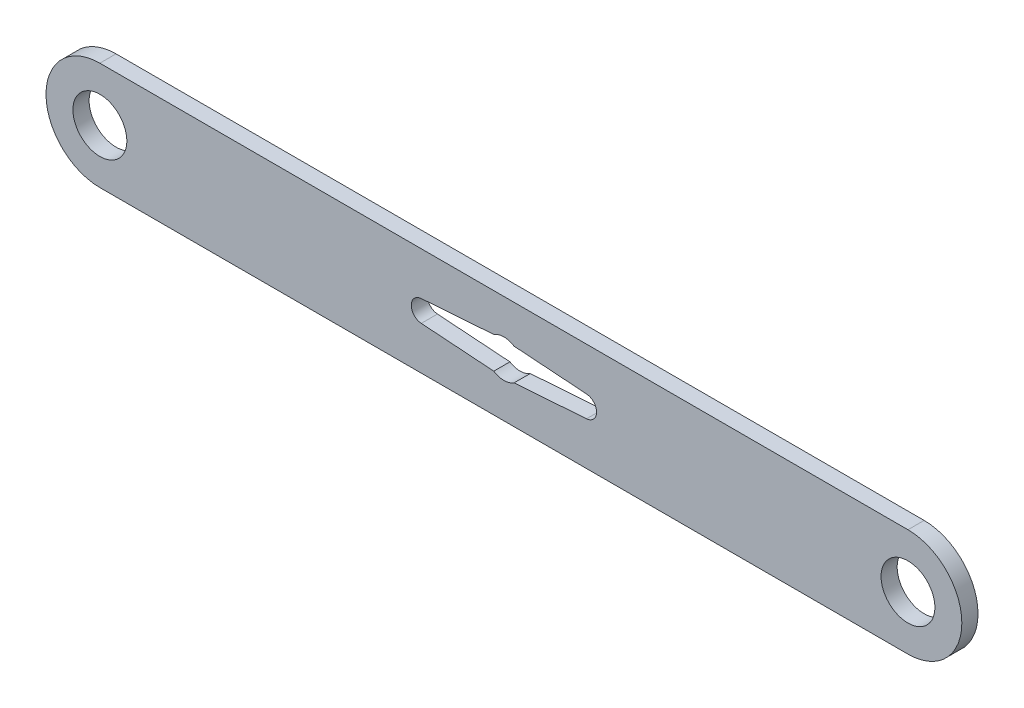
from build123d import *

# Parameters (mm, degrees)
SKETCH1_R           = 5
BOSS_EXTRUDE1_DEPTH = 3


with BuildPart() as part:
    # Sketch1 → Boss-Extrude1 (new body)
    with BuildSketch(Plane.XY):
        with BuildLine():
            Line((75, -10), (-75, -10))
            ThreePointArc((-75, -10), (-85, 0), (-75, 10))
            Line((-75, 10), (75, 10))
            ThreePointArc((75, 10), (85, 0), (75, -10))
        make_face()
        with Locations((75, 0)):
            Circle(SKETCH1_R, mode=Mode.SUBTRACT)
        with Locations((-75, 0)):
            Circle(SKETCH1_R, mode=Mode.SUBTRACT)
        with BuildLine():
            Line((-1.88348082, 2.95), (-15.34156858, 1.994983292))
            ThreePointArc((-15.34156858, 1.994983292), (-17.2, 0), (-15.34156858, -1.994983292))
            Line((-15.34156858, -1.994983292), (-1.88348082, -2.95))
            ThreePointArc((-1.88348082, -2.95), (0, -3.5), (1.88348082, -2.95))
            Line((1.88348082, -2.95), (15.34156858, -1.994983292))
            ThreePointArc((15.34156858, -1.994983292), (17.2, 0), (15.34156858, 1.994983292))
            Line((15.34156858, 1.994983292), (1.88348082, 2.95))
            ThreePointArc((1.88348082, 2.95), (0, 3.5), (-1.88348082, 2.95))
        make_face(mode=Mode.SUBTRACT)
    extrude(amount=BOSS_EXTRUDE1_DEPTH)


solid = part.part
